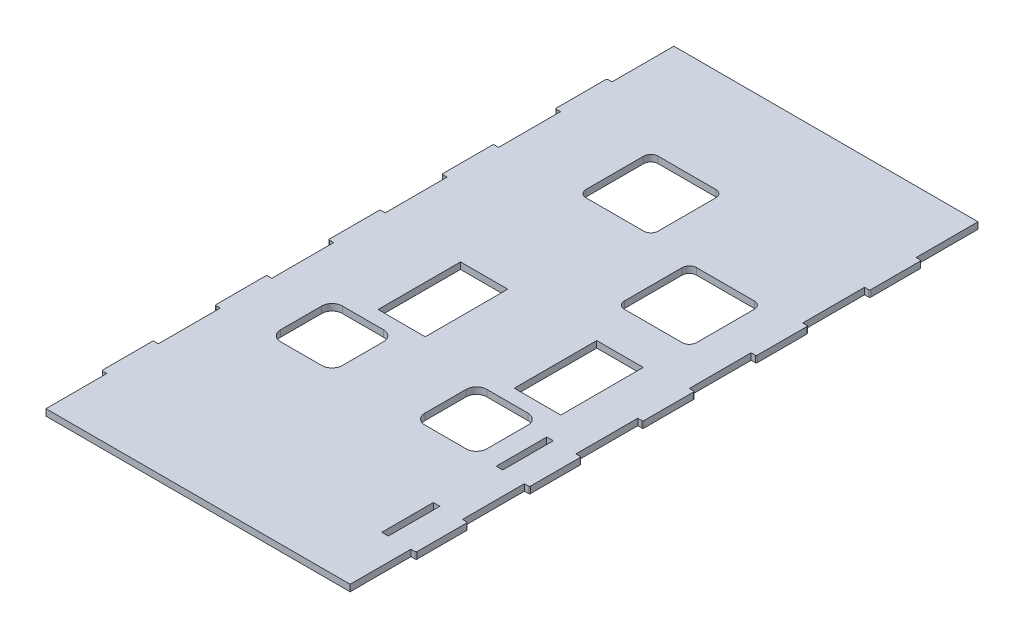
from build123d import *

# Parameters (mm, degrees)
SKETCH1_W           = 6.35
SKETCH1_H           = 50
SKETCH1_H_2         = 49
SKETCH1_W_2         = 45.825573981
SKETCH1_H_3         = 80
SKETCH1_W_3         = 45.139685757
BOSS_EXTRUDE1_DEPTH = 6.35
FILLET1_R           = 1


with BuildPart() as part:
    # Sketch1 → Boss-Extrude1 (new body)
    with BuildSketch(Plane(origin=(0, 0, 0), x_dir=(1, 0, 0), z_dir=(0, 1, 0))):
        Polygon((157.073624903, 348.621301775), (157.073624902, 288.621301775), (162.073624902, 288.621300264), (162.085917882, 238.621301775), (157.085917882, 238.621301775), (157.085917882, 178.621301775), (162.085917882, 178.621301775), (162.085917882, 128.621301775), (157.085917882, 128.621301775), (157.085917882, 68.621301775), (162.085917882, 68.621301775), (162.085917882, 18.621301775), (157.085917882, 18.621301775), (157.085917882, -41.378698225), (162.085917882, -41.378698225), (162.085917882, -91.378698225), (157.085917882, -91.378698225), (157.085917882, -151.378698225), (162.085917882, -151.378698225), (162.085917882, -201.378698225), (157.085917882, -201.378698225), (157.085917882, -260.378698225), (-137.926375098, -260.378698225), (-137.926375098, -201.378698225), (-142.938668078, -201.378698225), (-142.938668078, -151.378698225), (-137.926375098, -151.378698225), (-137.926375098, -91.378698225), (-142.926375098, -91.378698225), (-142.926375098, -41.378698225), (-137.926375098, -41.378698225), (-137.926375098, 18.621301775), (-142.938668078, 18.621301775), (-142.938668078, 68.621301775), (-137.926375098, 68.621301775), (-137.926375098, 128.621301775), (-142.938668078, 128.621301775), (-142.938668078, 178.621301775), (-137.926375098, 178.621301775), (-137.926375098, 238.621301775), (-142.938668078, 238.621301775), (-142.938668078, 288.621301775), (-137.926375097, 288.621301775), (-137.926375097, 348.621301775), align=None)
        with BuildLine():
            Line((-80.468838102, -30.378698225), (-40.468838102, -30.378698225))
            ThreePointArc((-40.468838102, -30.378698225), (-33.39777029, -33.307630413), (-30.468838102, -40.378698225))
            Line((-30.468838102, -40.378698225), (-30.468838102, -80.378698225))
            ThreePointArc((-30.468838102, -80.378698225), (-33.39777029, -87.449766037), (-40.468838102, -90.378698225))
            Line((-40.468838102, -90.378698225), (-80.468838102, -90.378698225))
            ThreePointArc((-80.468838102, -90.378698225), (-87.539905914, -87.449766037), (-90.468838102, -80.378698225))
            Line((-90.468838102, -80.378698225), (-90.468838102, -40.378698225))
            ThreePointArc((-90.468838102, -40.378698225), (-87.539905914, -33.307630413), (-80.468838102, -30.378698225))
        make_face(mode=Mode.SUBTRACT)
        with BuildLine():
            Line((59.585917882, -30.378698225), (99.585917882, -30.378698225))
            ThreePointArc((99.585917882, -30.378698225), (106.656985694, -33.307630413), (109.585917882, -40.378698225))
            Line((109.585917882, -40.378698225), (109.585917882, -80.378698225))
            ThreePointArc((109.585917882, -80.378698225), (106.656985694, -87.449766037), (99.585917882, -90.378698225))
            Line((99.585917882, -90.378698225), (59.585917882, -90.378698225))
            ThreePointArc((59.585917882, -90.378698225), (52.51485007, -87.449766037), (49.585917882, -80.378698225))
            Line((49.585917882, -80.378698225), (49.585917882, -40.378698225))
            ThreePointArc((49.585917882, -40.378698225), (52.51485007, -33.307630413), (59.585917882, -30.378698225))
        make_face(mode=Mode.SUBTRACT)
        with Locations((131.910917882, -176.378698225)):
            Rectangle(SKETCH1_W, SKETCH1_H, mode=Mode.SUBTRACT)
        with Locations((131.910917882, -65.878698225)):
            Rectangle(SKETCH1_W, SKETCH1_H_2, mode=Mode.SUBTRACT)
        with BuildLine():
            Line((-53.198026561, 248.621301775), (2.801973439, 248.621301775))
            ThreePointArc((2.801973439, 248.621301775), (7.751720908, 246.571049243), (9.801973439, 241.621301775))
            Line((9.801973439, 241.621301775), (9.801973439, 185.621301775))
            ThreePointArc((9.801973439, 185.621301775), (7.751720908, 180.671554307), (2.801973439, 178.621301775))
            Line((2.801973439, 178.621301775), (-53.198026561, 178.621301775))
            ThreePointArc((-53.198026561, 178.621301775), (-58.147774029, 180.671554307), (-60.198026561, 185.621301775))
            Line((-60.198026561, 185.621301775), (-60.198026561, 241.621301775))
            ThreePointArc((-60.198026561, 241.621301775), (-58.147774029, 246.571049243), (-53.198026561, 248.621301775))
        make_face(mode=Mode.SUBTRACT)
        with BuildLine():
            Line((59.085917882, 173.621301775), (115.085917882, 173.621301775))
            ThreePointArc((115.085917882, 173.621301775), (120.03566535, 171.571049243), (122.085917882, 166.621301775))
            Line((122.085917882, 166.621301775), (122.085917882, 110.621301775))
            ThreePointArc((122.085917882, 110.621301775), (120.03566535, 105.671554307), (115.085917882, 103.621301775))
            Line((115.085917882, 103.621301775), (59.085917882, 103.621301775))
            ThreePointArc((59.085917882, 103.621301775), (54.136170414, 105.671554307), (52.085917882, 110.621301775))
            Line((52.085917882, 110.621301775), (52.085917882, 166.621301775))
            ThreePointArc((52.085917882, 166.621301775), (54.136170414, 171.571049243), (59.085917882, 173.621301775))
        make_face(mode=Mode.SUBTRACT)
        with Locations((-37.285239571, 23.936670646)):
            Rectangle(SKETCH1_W_2, SKETCH1_H_3, mode=Mode.SUBTRACT)
        with Locations((94.516075004, 23.936670646)):
            Rectangle(SKETCH1_W_3, SKETCH1_H_3, mode=Mode.SUBTRACT)
    extrude(amount=BOSS_EXTRUDE1_DEPTH)

    # Fillet1
    fillet1_edges = [part.edges().sort_by_distance(p)[0] for p in [
        (-142.938668078, 3.175, -288.621301775),
        (-142.938668078, 3.175, -238.621301775),
        (-142.938668078, 3.175, -178.621301775),
        (-142.938668078, 3.175, -128.621301775),
        (-142.938668078, 3.175, -68.621301775),
        (-142.938668078, 3.175, -18.621301775),
        (-142.926375098, 3.175, 41.378698225),
        (-142.926375098, 3.175, 91.378698225),
        (-140.432521588, 0, 151.378698225),
        (-142.938668078, 3.175, 201.378698225),
        (162.073624902, 3.175, -288.621300264),
        (162.085917882, 3.175, -238.621301775),
        (162.085917882, 3.175, -178.621301775),
        (162.085917882, 3.175, -128.621301775),
        (162.085917882, 3.175, -68.621301775),
        (162.085917882, 3.175, -18.621301775),
        (162.085917882, 3.175, 41.378698225),
        (162.085917882, 3.175, 91.378698225),
        (162.085917882, 3.175, 151.378698225),
        (162.085917882, 3.175, 201.378698225),
    ]]
    fillet(fillet1_edges, radius=FILLET1_R)


solid = part.part
